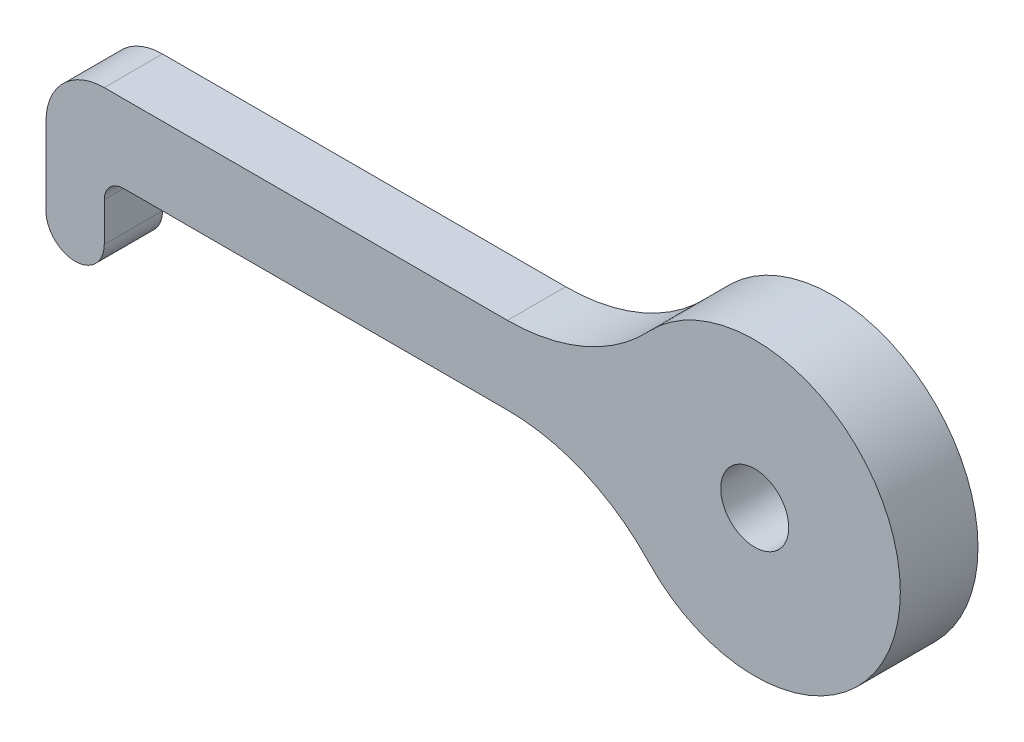
from build123d import *

# Parameters (mm, degrees)
ESBO_O1_R                = 7.5
ESBO_O1_R_2              = 1.75
RESSALTO_EXTRUS_O1_DEPTH = 4
RESSALTO_EXTRUS_O2_START = -3
RESSALTO_EXTRUS_O2_DEPTH = 3
FILETE1_R                = 3
FILETE2_R                = 1
FILETE3_R                = 10


with BuildPart() as part:
    # Esboço1 → Ressalto-extrusão1 (new body)
    with BuildSketch(Plane.XY):
        Circle(ESBO_O1_R)
        Circle(ESBO_O1_R_2, mode=Mode.SUBTRACT)
    extrude(amount=RESSALTO_EXTRUS_O1_DEPTH)

    # Esboço2 → Ressalto-extrusão2 (add)
    with BuildSketch(Plane.XY.offset(4).offset(RESSALTO_EXTRUS_O2_START)):
        with BuildLine():
            Line((-7.228416147, 2), (-36.5, 2))
            Line((-36.5, 2), (-36.5, -5))
            ThreePointArc((-36.5, -5), (-35, -6.5), (-33.5, -5))
            Line((-33.5, -5), (-33.5, -2))
            Line((-33.5, -2), (-7.228416147, -2))
            ThreePointArc((-7.228416147, -2), (-7.5, 0), (-7.228416147, 2))
        make_face()
    extrude(amount=RESSALTO_EXTRUS_O2_DEPTH)

    # Filete1
    filete1_edges = [part.edges().sort_by_distance(p)[0] for p in [
        (-36.5, 2, 2.5),
    ]]
    fillet(filete1_edges, radius=FILETE1_R)

    # Filete2
    filete2_edges = [part.edges().sort_by_distance(p)[0] for p in [
        (-33.5, -2, 2.5),
    ]]
    fillet(filete2_edges, radius=FILETE2_R)

    # Filete3
    filete3_edges = [part.edges().sort_by_distance(p)[0] for p in [
        (-7.228416147, -2, 2.5),
        (-7.228416147, 2, 2.5),
    ]]
    fillet(filete3_edges, radius=FILETE3_R)


solid = part.part
